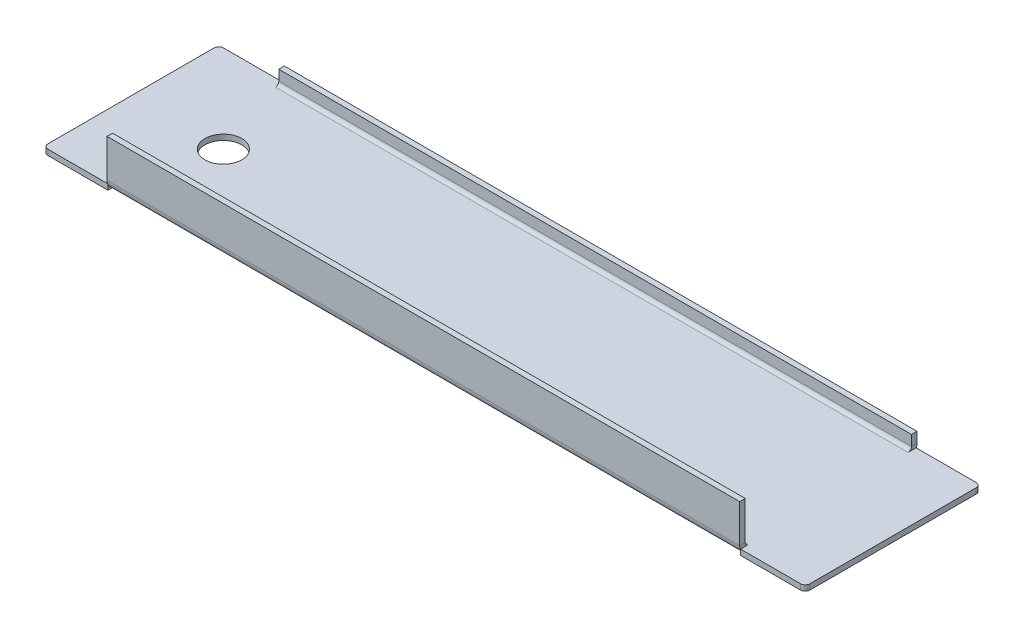
from build123d import *

# Parameters (mm, degrees)
FLANGE_BASE2_DEPTH       = 82.5
CORTE_EXTRUS_O3_START    = -82.5
CORTE_EXTRUS_O3_DEPTH    = 14
CORTE_EXTRUS_O3_START_2  = 68.5
CORTE_EXTRUS_O3_2_DEPTH  = 14
ESBO_O12_W               = 14
ESBO_O12_H               = 1.2
RESSALTO_EXTRUS_O1_DEPTH = 19
FILETE1_R                = 1
ESBO_O13_R               = 4
CORTE_EXTRUS_O4_DEPTH    = 86.316645504


# Read off the part's stored shape, not the designer's step: Corte-extrusão3
# Sheet-metal steps are written as plain solids
with BuildPart() as part:
    # Esboço1 → Flange-base2 (new, symmetric)
    with BuildSketch(Plane(origin=(0, 0, 0), x_dir=(0, 0, -1), z_dir=(1, 0, 0))):
        with BuildLine():
            Line((-18, 9), (-18, 0.7366))
            ThreePointArc((-18, 0.7366), (-17.784254855, 0.215745145), (-17.2634, 0))
            Line((-17.2634, 0), (17.2634, 0))
            ThreePointArc((17.2634, 0), (17.784254855, 0.215745145), (18, 0.7366))
            Line((18, 0.7366), (18, 3))
            Line((18, 3), (19.2, 3))
            Line((19.2, 3), (19.2, 0.7366))
            ThreePointArc((19.2, 0.7366), (18.632782992, -0.632782992), (17.2634, -1.2))
            Line((17.2634, -1.2), (-17.2634, -1.2))
            ThreePointArc((-17.2634, -1.2), (-18.632782992, -0.632782992), (-19.2, 0.7366))
            Line((-19.2, 0.7366), (-19.2, 9))
            Line((-19.2, 9), (-18, 9))
        make_face()
    extrude(amount=FLANGE_BASE2_DEPTH, both=True)

    # Corte-extrusão3 outline → Corte-extrusão3 (cut)
    with BuildSketch(Plane.YZ.offset(CORTE_EXTRUS_O3_START)):
        with BuildLine():
            Line((-1.2, 17.2634), (0, 17.2634))
            ThreePointArc((0, 17.2634), (0.215745145, 17.784254855), (0.7366, 18))
            Line((0.7366, 18), (9, 18))
            Line((9, 18), (9, 19.2))
            Line((9, 19.2), (0.7366, 19.2))
            ThreePointArc((0.7366, 19.2), (-0.632782992, 18.632782992), (-1.2, 17.2634))
        make_face()
        with BuildLine():
            ThreePointArc((0.7366, -18), (0.215745145, -17.784254855), (0, -17.2634))
            Line((0, -17.2634), (-1.2, -17.2634))
            ThreePointArc((-1.2, -17.2634), (-0.632782992, -18.632782992), (0.7366, -19.2))
            Line((0.7366, -19.2), (3, -19.2))
            Line((3, -19.2), (3, -18))
            Line((3, -18), (0.7366, -18))
        make_face()
    extrude(amount=CORTE_EXTRUS_O3_DEPTH, mode=Mode.SUBTRACT)

    # Corte-extrus_o3 2 outline → Corte-extrus_o3 2 (cut)
    with BuildSketch(Plane.YZ.offset(CORTE_EXTRUS_O3_START_2)):
        with BuildLine():
            Line((-1.2, 17.2634), (0, 17.2634))
            ThreePointArc((0, 17.2634), (0.215745145, 17.784254855), (0.7366, 18))
            Line((0.7366, 18), (9, 18))
            Line((9, 18), (9, 19.2))
            Line((9, 19.2), (0.7366, 19.2))
            ThreePointArc((0.7366, 19.2), (-0.632782992, 18.632782992), (-1.2, 17.2634))
        make_face()
        with BuildLine():
            ThreePointArc((0.7366, -18), (0.215745145, -17.784254855), (0, -17.2634))
            Line((0, -17.2634), (-1.2, -17.2634))
            ThreePointArc((-1.2, -17.2634), (-0.632782992, -18.632782992), (0.7366, -19.2))
            Line((0.7366, -19.2), (3, -19.2))
            Line((3, -19.2), (3, -18))
            Line((3, -18), (0.7366, -18))
        make_face()
    extrude(amount=CORTE_EXTRUS_O3_2_DEPTH, mode=Mode.SUBTRACT)

    # Esboço12 → Ressalto-extrusão1 (add, symmetric)
    with BuildSketch(Plane.XY):
        with Locations((75.5, -0.6)):
            Rectangle(ESBO_O12_W, ESBO_O12_H)
        with Locations((-75.5, -0.6)):
            Rectangle(ESBO_O12_W, ESBO_O12_H)
    extrude(amount=RESSALTO_EXTRUS_O1_DEPTH, both=True)

    # Filete1
    filete1_edges = [part.edges().sort_by_distance(p)[0] for p in [
        (82.5, -0.6, -19),
        (82.5, -0.6, 19),
        (-82.5, -0.6, -19),
        (-82.5, -0.6, 19),
    ]]
    fillet(filete1_edges, radius=FILETE1_R)

    # Esboço13 → Corte-extrusão4 (cut, through all)
    with BuildSketch(Plane.XZ.offset(1.2)):
        with Locations(Location((-62.5, 0, 0), (0, 0, 270))):
            Circle(ESBO_O13_R)
    extrude(amount=-CORTE_EXTRUS_O4_DEPTH, mode=Mode.SUBTRACT)


solid = part.part
